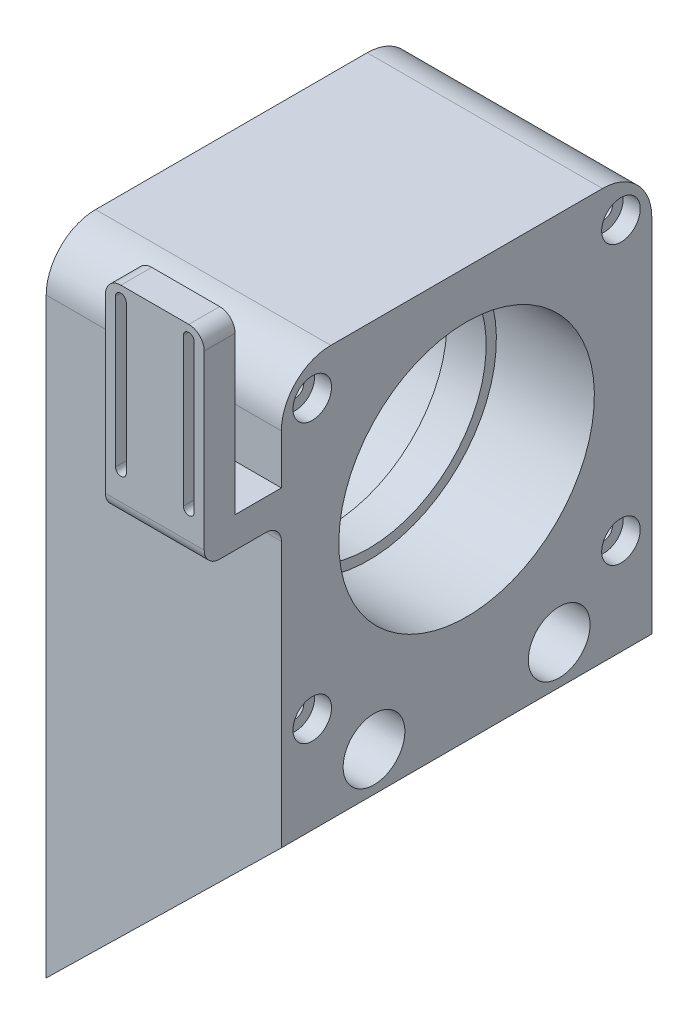
from build123d import *

# Parameters (mm, degrees)
BOSS_EXTRUDE1_DEPTH = 120
SKETCH3_R           = 4.25
CUT_EXTRUDE1_DEPTH  = 120
SKETCH5_R           = 10
CUT_EXTRUDE2_DEPTH  = 53
SKETCH6_R           = 4.25
CUT_EXTRUDE3_DEPTH  = 103
SKETCH7_W           = 76.2
SKETCH7_H           = 120
BOSS_EXTRUDE2_DEPTH = 101.6
SKETCH8_R           = 41.4
CUT_EXTRUDE4_DEPTH  = 31.75
CUT_EXTRUDE5_START  = -31.75
SKETCH9_R           = 41.4
CUT_EXTRUDE5_DEPTH  = 31.75
SKETCH10_R          = 38.1
CUT_EXTRUDE6_DEPTH  = 76.2
SKETCH13_W          = 76.2
SKETCH13_H          = 120
BOSS_EXTRUDE3_DEPTH = 6
SKETCH11_R          = 2.75
CUT_EXTRUDE7_DEPTH  = 84.4
SKETCH12_R          = 6.25
CUT_EXTRUDE8_DEPTH  = 5.5
FILLET1_R           = 16
SKETCH18_W          = 32
SKETCH18_H          = 10
BOSS_EXTRUDE6_DEPTH = 15
SKETCH20_W          = 32
SKETCH20_H          = 65.882542047
BOSS_EXTRUDE7_DEPTH = 10
FILLET3_R           = 5


with BuildPart() as part:
    # Sketch1 → Boss-Extrude1 (new body)
    with BuildSketch(Plane.XY):
        Polygon((381, 457.2), (457.2, 457.2), (457.2, 431.8), (381, 357.2), align=None)
    extrude(amount=BOSS_EXTRUDE1_DEPTH)

    # Sketch3 → Cut-Extrude1 (cut)
    with BuildSketch(Plane(origin=(457.2, 0, 0), x_dir=(0, 0, -1), z_dir=(1, 0, 0))):
        with Locations((-90, 394.5)):
            Circle(SKETCH3_R)
        with Locations((-30, 394.5)):
            Circle(SKETCH3_R)
    extrude(amount=-CUT_EXTRUDE1_DEPTH, mode=Mode.SUBTRACT)

    # Sketch5 → Cut-Extrude2 (cut)
    with BuildSketch(Plane(origin=(457.2, 0, 0), x_dir=(0, 0, -1), z_dir=(1, 0, 0))):
        with Locations((-90, 394.5)):
            Circle(SKETCH5_R)
        with Locations((-30, 394.5)):
            Circle(SKETCH5_R)
        with Locations((-90, 444.5)):
            Circle(SKETCH5_R)
        with Locations((-30, 444.5)):
            Circle(SKETCH5_R)
    extrude(amount=-CUT_EXTRUDE2_DEPTH, mode=Mode.SUBTRACT)

    # Sketch6 → Cut-Extrude3 (cut)
    with BuildSketch(Plane(origin=(457.2, 0, 0), x_dir=(0, 0, -1), z_dir=(1, 0, 0))):
        with Locations((-90, 444.5)):
            Circle(SKETCH6_R)
        with Locations((-30, 444.5)):
            Circle(SKETCH6_R)
    extrude(amount=-CUT_EXTRUDE3_DEPTH, mode=Mode.SUBTRACT)

    # Sketch7 → Boss-Extrude2 (add)
    with BuildSketch(Plane(origin=(0, 457.2, 0), x_dir=(1, 0, 0), z_dir=(0, 1, 0))):
        with Locations((419.1, -60)):
            Rectangle(SKETCH7_W, SKETCH7_H)
    extrude(amount=BOSS_EXTRUDE2_DEPTH)

    # Sketch8 → Cut-Extrude4 (cut)
    with BuildSketch(Plane.ZY.offset(-381)):
        with Locations((60, 508)):
            Circle(SKETCH8_R)
    extrude(amount=-CUT_EXTRUDE4_DEPTH, mode=Mode.SUBTRACT)

    # Sketch9 → Cut-Extrude5 (cut)
    with BuildSketch(Plane(origin=(457.2, 0, 0), x_dir=(0, 0, -1), z_dir=(1, 0, 0)).offset(CUT_EXTRUDE5_START)):
        with Locations((-60, 508)):
            Circle(SKETCH9_R)
    extrude(amount=CUT_EXTRUDE5_DEPTH, mode=Mode.SUBTRACT)

    # Sketch10 → Cut-Extrude6 (cut)
    with BuildSketch(Plane(origin=(457.2, 0, 0), x_dir=(0, 0, -1), z_dir=(1, 0, 0))):
        with Locations((-60, 508)):
            Circle(SKETCH10_R)
    extrude(amount=-CUT_EXTRUDE6_DEPTH, mode=Mode.SUBTRACT)

    # Sketch13 → Boss-Extrude3 (add)
    with BuildSketch(Plane(origin=(0, 558.8, 0), x_dir=(1, 0, 0), z_dir=(0, 1, 0))):
        with Locations((419.1, -60)):
            Rectangle(SKETCH13_W, SKETCH13_H)
    extrude(amount=BOSS_EXTRUDE3_DEPTH)

    # Sketch11 → Cut-Extrude7 (cut)
    with BuildSketch(Plane(origin=(457.2, 0, 0), x_dir=(0, 0, -1), z_dir=(1, 0, 0))):
        with Locations((-110, 553)):
            Circle(SKETCH11_R)
        with Locations((-10, 553)):
            Circle(SKETCH11_R)
        with Locations((-110, 463)):
            Circle(SKETCH11_R)
        with Locations((-10, 463)):
            Circle(SKETCH11_R)
    extrude(amount=-CUT_EXTRUDE7_DEPTH, mode=Mode.SUBTRACT)

    # Sketch12 → Cut-Extrude8 (cut)
    with BuildSketch(Plane(origin=(457.2, 0, 0), x_dir=(0, 0, -1), z_dir=(1, 0, 0))):
        with Locations((-110, 553)):
            Circle(SKETCH12_R)
        with Locations((-10, 553)):
            Circle(SKETCH12_R)
        with Locations((-10, 463)):
            Circle(SKETCH12_R)
        with Locations((-110, 463)):
            Circle(SKETCH12_R)
    extrude(amount=-CUT_EXTRUDE8_DEPTH, mode=Mode.SUBTRACT)

    # Fillet1
    fillet1_edges = [part.edges().sort_by_distance(p)[0] for p in [
        (419.1, 564.8, 0),
        (419.1, 564.8, 120),
    ]]
    fillet(fillet1_edges, radius=FILLET1_R)

    # Sketch18 → Boss-Extrude6 (add)
    with BuildSketch(Plane.XY.offset(120)):
        with Locations((441.2, 527.8)):
            Rectangle(SKETCH18_W, SKETCH18_H)
    extrude(amount=BOSS_EXTRUDE6_DEPTH)

    # Sketch20 → Boss-Extrude7 (add)
    with BuildSketch(Plane.XY.offset(135)):
        with Locations((441.2, 555.741271024)):
            Rectangle(SKETCH20_W, SKETCH20_H)
        with BuildLine():
            ThreePointArc((450.45, 584.682542047), (452.2, 586.432542047), (453.95, 584.682542047))
            Line((453.95, 584.682542047), (453.95, 536.8))
            ThreePointArc((453.95, 536.8), (452.2, 535.05), (450.45, 536.8))
            Line((450.45, 536.8), (450.45, 584.682542047))
        make_face(mode=Mode.SUBTRACT)
        with BuildLine():
            ThreePointArc((428.45, 584.682542047), (430.2, 586.432542047), (431.95, 584.682542047))
            Line((431.95, 584.682542047), (431.95, 536.8))
            ThreePointArc((431.95, 536.8), (430.2, 535.05), (428.45, 536.8))
            Line((428.45, 536.8), (428.45, 584.682542047))
        make_face(mode=Mode.SUBTRACT)
    extrude(amount=BOSS_EXTRUDE7_DEPTH)

    # Fillet3
    fillet3_edges = [part.edges().sort_by_distance(p)[0] for p in [
        (441.2, 522.8, 145),
        (425.2, 588.682542047, 140),
        (457.2, 588.682542047, 140),
        (441.2, 522.8, 120),
    ]]
    fillet(fillet3_edges, radius=FILLET3_R)


solid = part.part
